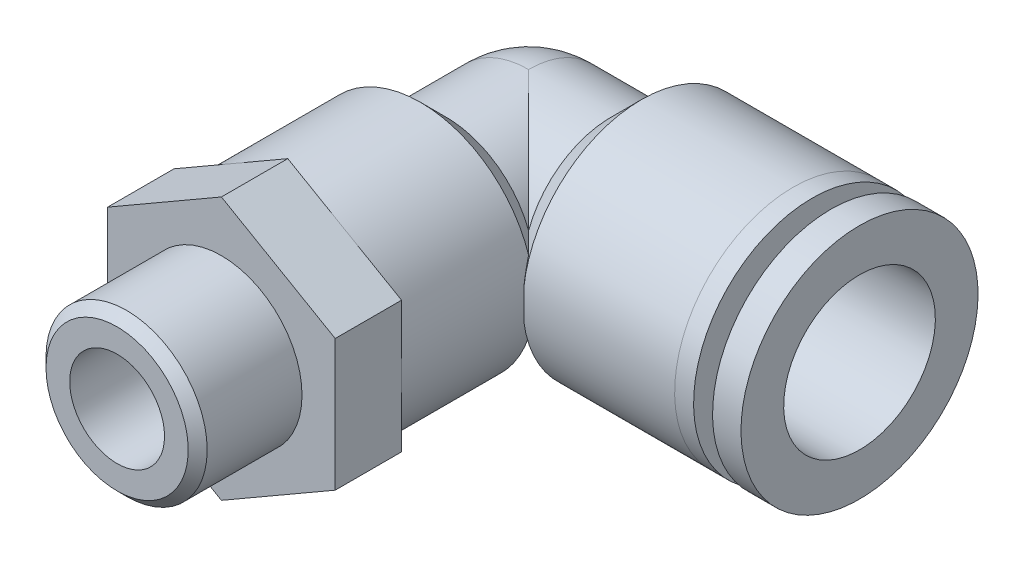
from build123d import *

# Parameters (mm, degrees)
SKETCH2_R          = 9.921875
SKETCH2_R_2        = 7.14375
EXTRUDE1_DEPTH     = 1.5875
SKETCH7_R          = 6.35
CUT_EXTRUDE1_DEPTH = 22.225
EXTRUDE2_DEPTH     = 5.55625
SKETCH6_R          = 6.746875
EXTRUDE3_DEPTH     = 8.73125
CHAMFER1_SIZE      = 0.79375
SKETCH9_R          = 3.96875
CUT_EXTRUDE2_DEPTH = 14.2875


with BuildPart() as part:
    # Sketch1 → Revolve1 (revolve)
    with BuildSketch(Plane.XY):
        with BuildLine():
            Line((0, 7.381875), (6.905625, 7.381875))
            Line((6.905625, 7.381875), (9.445625, 9.921875))
            Line((9.445625, 9.921875), (22.145625, 9.921875))
            Line((22.145625, 9.921875), (22.145625, 7.14375))
            Line((22.145625, 7.14375), (25.320625, 7.14375))
            Line((25.320625, 7.14375), (25.320625, 9.921875))
            Line((25.320625, 9.921875), (27.701875, 9.921875))
            Line((27.701875, 9.921875), (27.701875, 0))
            Line((27.701875, 0), (-7.381875, 0))
            ThreePointArc((-7.381875, 0), (-5.21977387, 5.21977387), (0, 7.381875))
        make_face()
    revolve(axis=Axis((27.701875, 0, 0), (-1, 0, 0)))


with BuildPart() as revolve3_tool:
    # Sketch4 → Revolve3 (revolve)
    with BuildSketch(Plane(origin=(0, 0, 0), x_dir=(0, 0, -1), z_dir=(1, 0, 0))):
        with BuildLine():
            Line((7.381875, 0), (-20.16125, 0))
            Line((-20.16125, 0), (-20.16125, 9.525))
            Line((-20.16125, 9.525), (-9.04875, 9.525))
            Line((-9.04875, 9.525), (-6.905625, 7.381875))
            Line((-6.905625, 7.381875), (0, 7.381875))
            ThreePointArc((0, 7.381875), (5.21977387, 5.21977387), (7.381875, 0))
        make_face()
    revolve(axis=Axis((0, 0, -7.381875), (0, 0, 1)))


with BuildPart() as part_1:
    add(part.part)


with BuildPart() as part_2:
    # Revolve3: joined with revolve3_tool
    add(part_1.part.fuse(revolve3_tool.part, tol=0.00001))

    # Sketch7 → Cut-Extrude1 (cut)
    with BuildSketch(Plane(origin=(27.701875, 0, 0), x_dir=(0, 0, -1), z_dir=(1, 0, 0))):
        with Locations(Location((0, 0, 0), (0, 0, 90))):
            Circle(SKETCH7_R)
    extrude(amount=-CUT_EXTRUDE1_DEPTH, mode=Mode.SUBTRACT)


with BuildPart() as body_2:
    # Sketch2 → Extrude1 (new body)
    with BuildSketch(Plane(origin=(22.145625, 0, 0), x_dir=(0, 0, -1), z_dir=(1, 0, 0))):
        with Locations(Location((0, 0, 0), (0, 0, 90))):
            Circle(SKETCH2_R)
        with Locations(Location((0, 0, 0), (0, 0, 90))):
            Circle(SKETCH2_R_2, mode=Mode.SUBTRACT)
    extrude(amount=EXTRUDE1_DEPTH)


with BuildPart() as body_3:
    # Sketch5 → Extrude2 (new body)
    with BuildSketch(Plane.XY.offset(20.16125)):
        Polygon((0, 10.998522628), (-9.525, 5.499261314), (-9.525, -5.499261314), (0, -10.998522628), (9.525, -5.499261314), (9.525, 5.499261314), align=None)
    extrude(amount=EXTRUDE2_DEPTH)

    # Sketch6 → Extrude3 (add)
    with BuildSketch(Plane.XY.offset(25.7175)):
        Circle(SKETCH6_R)
    extrude(amount=EXTRUDE3_DEPTH)

    # Chamfer1
    chamfer1_edges = [body_3.edges().sort_by_distance(p)[0] for p in [
        (-6.746875, 0, 34.44875),
    ]]
    chamfer(chamfer1_edges, length=CHAMFER1_SIZE)

    # Sketch9 → Cut-Extrude2 (cut)
    with BuildSketch(Plane.XY.offset(34.44875)):
        Circle(SKETCH9_R)
    extrude(amount=-CUT_EXTRUDE2_DEPTH, mode=Mode.SUBTRACT)


solid = Compound([part_2.part, body_2.part, body_3.part])
